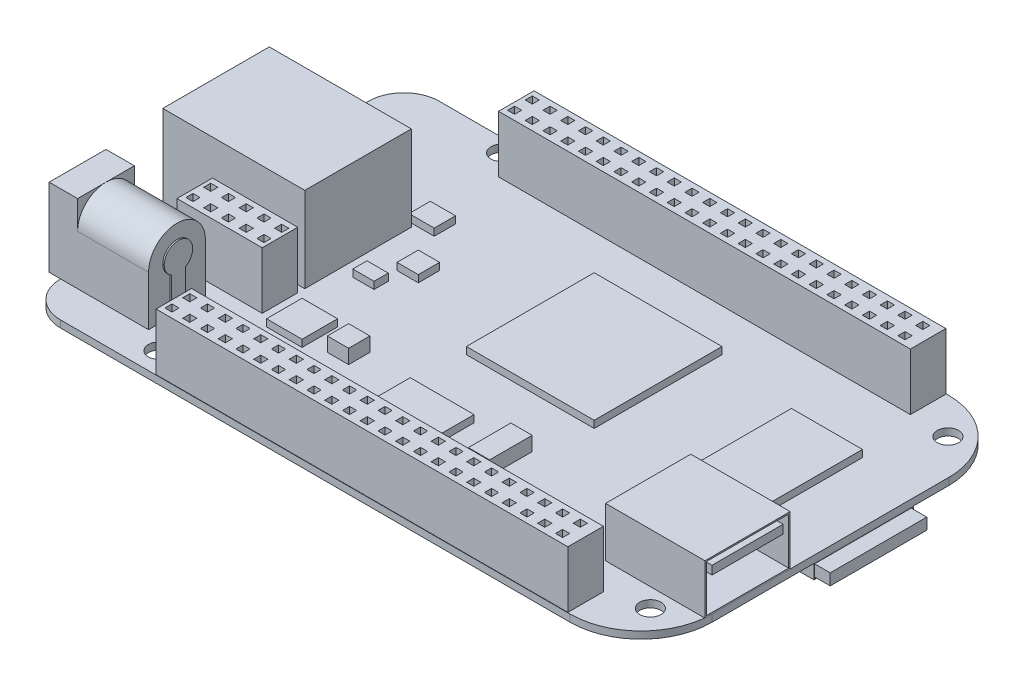
from build123d import *

# Parameters (mm, degrees)
SKETCH1_R               = 1.5
BOSS_EXTRUDE3_DEPTH     = 1
SKETCH2_W               = 12
SKETCH2_H               = 5
SKETCH2_W_2             = 58
BOSS_EXTRUDE5_DEPTH     = 8
SKETCH3_W               = 1
SKETCH3_H               = 1
CUT_EXTRUDE2_DEPTH      = 7
SKETCH4_W               = 20
SKETCH4_H               = 15
BOSS_EXTRUDE6_DEPTH     = 12
CUT_EXTRUDE3_DEPTH      = 15
SKETCH6_W               = 14
SKETCH6_H               = 8
BOSS_EXTRUDE7_DEPTH     = 11
CUT_EXTRUDE5_DEPTH      = 10
SKETCH9_R               = 3
SKETCH9_R_2             = 0.2
CUT_EXTRUDE6_DEPTH      = 10
SKETCH10_W              = 14
SKETCH10_H              = 12
BOSS_EXTRUDE9_DEPTH     = 7
SKETCH11_W              = 11.6
SKETCH11_H              = 6.6
SKETCH11_W_2            = 10
SKETCH11_H_2            = 1.2
CUT_EXTRUDE7_DEPTH      = 10
SKETCH12_W              = 15
SKETCH12_H              = 14
BOSS_EXTRUDE11_DEPTH    = 2
SHELL1_T                = -0.1
SKETCH13_W              = 13.6
SKETCH13_H              = 1.6
BOSS_EXTRUDE12_DEPTH    = 17
SKETCH14_W              = 18
SKETCH14_H              = 18
BOSS_EXTRUDE13_DEPTH    = 1
SKETCH14_W_2            = 10
SKETCH14_H_2            = 13
BOSS_EXTRUDE13_2_DEPTH  = 1
SKETCH14_W_3            = 3.540159879
SKETCH14_H_3            = 3
BOSS_EXTRUDE13_3_DEPTH  = 1
SKETCH14_W_4            = 3
BOSS_EXTRUDE13_4_DEPTH  = 1
SKETCH14_H_4            = 2
BOSS_EXTRUDE13_5_DEPTH  = 1
SKETCH14_W_5            = 9
SKETCH14_H_5            = 9
BOSS_EXTRUDE13_6_DEPTH  = 1
SKETCH14_W_6            = 5
SKETCH14_H_6            = 5
BOSS_EXTRUDE13_7_DEPTH  = 1
SKETCH15_W              = 8
SKETCH15_H              = 7
BOSS_EXTRUDE14_DEPTH    = 4
CUT_EXTRUDE8_DEPTH      = 94.673517471
CUT_EXTRUDE8_DEPTH_BACK = 94.673517471
SHELL2_T                = -0.1
BOSS_EXTRUDE15_DEPTH    = 7
SKETCH18_R              = 0.1
CUT_EXTRUDE9_DEPTH      = 6
SKETCH19_W              = 3
SKETCH19_H              = 3
SKETCH19_H_2            = 6
SKETCH19_W_2            = 1.784134307
SKETCH19_H_3            = 3.811559656
BOSS_EXTRUDE17_DEPTH    = 2
BOSS_EXTRUDE18_DEPTH    = 0.2


with BuildPart() as part:
    # Sketch1 → Boss-Extrude3 (new body)
    with BuildSketch(Plane(origin=(0, 0, 0), x_dir=(1, 0, 0), z_dir=(0, 1, 0))):
        with BuildLine():
            Line((-38.570655458, -26.67), (33.18, -26.67))
            ThreePointArc((33.18, -26.67), (40.251067812, -23.741067812), (43.18, -16.67))
            Line((43.18, -16.67), (43.18, 16.67))
            ThreePointArc((43.18, 16.67), (40.251067812, 23.741067812), (33.18, 26.67))
            Line((33.18, 26.67), (-38.570655458, 26.67))
            ThreePointArc((-38.570655458, 26.67), (-42.106189364, 25.205533906), (-43.570655458, 21.67))
            Line((-43.570655458, 21.67), (-43.570655458, -21.67))
            ThreePointArc((-43.570655458, -21.67), (-42.106189364, -25.205533906), (-38.570655458, -26.67))
        make_face()
        with Locations((38.14309061, -20.32)):
            Circle(SKETCH1_R, mode=Mode.SUBTRACT)
        with Locations((38.14309061, 21.59)):
            Circle(SKETCH1_R, mode=Mode.SUBTRACT)
        with Locations((-27.89690939, -23.495)):
            Circle(SKETCH1_R, mode=Mode.SUBTRACT)
        with Locations((-27.89690939, 24.765)):
            Circle(SKETCH1_R, mode=Mode.SUBTRACT)
    extrude(amount=BOSS_EXTRUDE3_DEPTH)

    # Sketch2 → Boss-Extrude5 (add)
    with BuildSketch(Plane(origin=(0, 1, 0), x_dir=(1, 0, 0), z_dir=(0, 1, 0))):
        with Locations((-31.18, -9.17)):
            Rectangle(SKETCH2_W, SKETCH2_H)
        with Locations((3.82, -24.12)):
            Rectangle(SKETCH2_W_2, SKETCH2_H)
        with Locations((3.82, 24.12)):
            Rectangle(SKETCH2_W_2, SKETCH2_H)
    extrude(amount=BOSS_EXTRUDE5_DEPTH)

    # Sketch3 → Cut-Extrude2 (cut)
    with BuildSketch(Plane(origin=(0, 9, 0), x_dir=(1, 0, 0), z_dir=(0, 1, 0))):
        with Locations((-21.68, 25.37)):
            Rectangle(SKETCH3_W, SKETCH3_H)
        with Locations((-21.68, -22.87)):
            Rectangle(SKETCH3_W, SKETCH3_H)
        with Locations((-24.18, 25.37)):
            Rectangle(SKETCH3_W, SKETCH3_H)
        with Locations((-19.18, 25.37)):
            Rectangle(SKETCH3_W, SKETCH3_H)
        with Locations((-16.68, 25.37)):
            Rectangle(SKETCH3_W, SKETCH3_H)
        with Locations((-14.18, 25.37)):
            Rectangle(SKETCH3_W, SKETCH3_H)
        with Locations((-11.68, 25.37)):
            Rectangle(SKETCH3_W, SKETCH3_H)
        with Locations((-9.18, 25.37)):
            Rectangle(SKETCH3_W, SKETCH3_H)
        with Locations((-6.68, 25.37)):
            Rectangle(SKETCH3_W, SKETCH3_H)
        with Locations((-4.18, 25.37)):
            Rectangle(SKETCH3_W, SKETCH3_H)
        with Locations((-1.68, 25.37)):
            Rectangle(SKETCH3_W, SKETCH3_H)
        with Locations((0.82, 25.37)):
            Rectangle(SKETCH3_W, SKETCH3_H)
        with Locations((3.32, 25.37)):
            Rectangle(SKETCH3_W, SKETCH3_H)
        with Locations((5.82, 25.37)):
            Rectangle(SKETCH3_W, SKETCH3_H)
        with Locations((8.32, 25.37)):
            Rectangle(SKETCH3_W, SKETCH3_H)
        with Locations((10.82, 25.37)):
            Rectangle(SKETCH3_W, SKETCH3_H)
        with Locations((13.32, 25.37)):
            Rectangle(SKETCH3_W, SKETCH3_H)
        with Locations((15.82, 25.37)):
            Rectangle(SKETCH3_W, SKETCH3_H)
        with Locations((18.32, 25.37)):
            Rectangle(SKETCH3_W, SKETCH3_H)
        with Locations((20.82, 25.37)):
            Rectangle(SKETCH3_W, SKETCH3_H)
        with Locations((23.32, 25.37)):
            Rectangle(SKETCH3_W, SKETCH3_H)
        with Locations((25.82, 25.37)):
            Rectangle(SKETCH3_W, SKETCH3_H)
        with Locations((28.32, 25.37)):
            Rectangle(SKETCH3_W, SKETCH3_H)
        with Locations((30.82, 25.37)):
            Rectangle(SKETCH3_W, SKETCH3_H)
        with Locations((-19.18, 22.87)):
            Rectangle(SKETCH3_W, SKETCH3_H)
        with Locations((-21.68, 22.87)):
            Rectangle(SKETCH3_W, SKETCH3_H)
        with Locations((-24.18, 22.87)):
            Rectangle(SKETCH3_W, SKETCH3_H)
        with Locations((30.82, 22.87)):
            Rectangle(SKETCH3_W, SKETCH3_H)
        with Locations((28.32, 22.87)):
            Rectangle(SKETCH3_W, SKETCH3_H)
        with Locations((25.82, 22.87)):
            Rectangle(SKETCH3_W, SKETCH3_H)
        with Locations((23.32, 22.87)):
            Rectangle(SKETCH3_W, SKETCH3_H)
        with Locations((20.82, 22.87)):
            Rectangle(SKETCH3_W, SKETCH3_H)
        with Locations((18.32, 22.87)):
            Rectangle(SKETCH3_W, SKETCH3_H)
        with Locations((15.82, 22.87)):
            Rectangle(SKETCH3_W, SKETCH3_H)
        with Locations((13.32, 22.87)):
            Rectangle(SKETCH3_W, SKETCH3_H)
        with Locations((10.82, 22.87)):
            Rectangle(SKETCH3_W, SKETCH3_H)
        with Locations((8.32, 22.87)):
            Rectangle(SKETCH3_W, SKETCH3_H)
        with Locations((5.82, 22.87)):
            Rectangle(SKETCH3_W, SKETCH3_H)
        with Locations((3.32, 22.87)):
            Rectangle(SKETCH3_W, SKETCH3_H)
        with Locations((0.82, 22.87)):
            Rectangle(SKETCH3_W, SKETCH3_H)
        with Locations((-1.68, 22.87)):
            Rectangle(SKETCH3_W, SKETCH3_H)
        with Locations((-4.18, 22.87)):
            Rectangle(SKETCH3_W, SKETCH3_H)
        with Locations((-6.68, 22.87)):
            Rectangle(SKETCH3_W, SKETCH3_H)
        with Locations((-9.18, 22.87)):
            Rectangle(SKETCH3_W, SKETCH3_H)
        with Locations((-11.68, 22.87)):
            Rectangle(SKETCH3_W, SKETCH3_H)
        with Locations((-14.18, 22.87)):
            Rectangle(SKETCH3_W, SKETCH3_H)
        with Locations((-16.68, 22.87)):
            Rectangle(SKETCH3_W, SKETCH3_H)
        with Locations((-24.18, -22.87)):
            Rectangle(SKETCH3_W, SKETCH3_H)
        with Locations((-19.18, -22.87)):
            Rectangle(SKETCH3_W, SKETCH3_H)
        with Locations((-16.68, -22.87)):
            Rectangle(SKETCH3_W, SKETCH3_H)
        with Locations((-14.18, -22.87)):
            Rectangle(SKETCH3_W, SKETCH3_H)
        with Locations((-11.68, -22.87)):
            Rectangle(SKETCH3_W, SKETCH3_H)
        with Locations((-9.18, -22.87)):
            Rectangle(SKETCH3_W, SKETCH3_H)
        with Locations((-6.68, -22.87)):
            Rectangle(SKETCH3_W, SKETCH3_H)
        with Locations((-4.18, -22.87)):
            Rectangle(SKETCH3_W, SKETCH3_H)
        with Locations((-1.68, -22.87)):
            Rectangle(SKETCH3_W, SKETCH3_H)
        with Locations((0.82, -22.87)):
            Rectangle(SKETCH3_W, SKETCH3_H)
        with Locations((3.32, -22.87)):
            Rectangle(SKETCH3_W, SKETCH3_H)
        with Locations((5.82, -22.87)):
            Rectangle(SKETCH3_W, SKETCH3_H)
        with Locations((8.32, -22.87)):
            Rectangle(SKETCH3_W, SKETCH3_H)
        with Locations((10.82, -22.87)):
            Rectangle(SKETCH3_W, SKETCH3_H)
        with Locations((13.32, -22.87)):
            Rectangle(SKETCH3_W, SKETCH3_H)
        with Locations((15.82, -22.87)):
            Rectangle(SKETCH3_W, SKETCH3_H)
        with Locations((18.32, -22.87)):
            Rectangle(SKETCH3_W, SKETCH3_H)
        with Locations((20.82, -22.87)):
            Rectangle(SKETCH3_W, SKETCH3_H)
        with Locations((23.32, -22.87)):
            Rectangle(SKETCH3_W, SKETCH3_H)
        with Locations((25.82, -22.87)):
            Rectangle(SKETCH3_W, SKETCH3_H)
        with Locations((28.32, -22.87)):
            Rectangle(SKETCH3_W, SKETCH3_H)
        with Locations((30.82, -22.87)):
            Rectangle(SKETCH3_W, SKETCH3_H)
        with Locations((30.82, -25.37)):
            Rectangle(SKETCH3_W, SKETCH3_H)
        with Locations((28.32, -25.37)):
            Rectangle(SKETCH3_W, SKETCH3_H)
        with Locations((25.82, -25.37)):
            Rectangle(SKETCH3_W, SKETCH3_H)
        with Locations((23.32, -25.37)):
            Rectangle(SKETCH3_W, SKETCH3_H)
        with Locations((20.82, -25.37)):
            Rectangle(SKETCH3_W, SKETCH3_H)
        with Locations((18.32, -25.37)):
            Rectangle(SKETCH3_W, SKETCH3_H)
        with Locations((15.82, -25.37)):
            Rectangle(SKETCH3_W, SKETCH3_H)
        with Locations((13.32, -25.37)):
            Rectangle(SKETCH3_W, SKETCH3_H)
        with Locations((10.82, -25.37)):
            Rectangle(SKETCH3_W, SKETCH3_H)
        with Locations((8.32, -25.37)):
            Rectangle(SKETCH3_W, SKETCH3_H)
        with Locations((5.82, -25.37)):
            Rectangle(SKETCH3_W, SKETCH3_H)
        with Locations((3.32, -25.37)):
            Rectangle(SKETCH3_W, SKETCH3_H)
        with Locations((0.82, -25.37)):
            Rectangle(SKETCH3_W, SKETCH3_H)
        with Locations((-1.68, -25.37)):
            Rectangle(SKETCH3_W, SKETCH3_H)
        with Locations((-4.18, -25.37)):
            Rectangle(SKETCH3_W, SKETCH3_H)
        with Locations((-6.68, -25.37)):
            Rectangle(SKETCH3_W, SKETCH3_H)
        with Locations((-9.18, -25.37)):
            Rectangle(SKETCH3_W, SKETCH3_H)
        with Locations((-11.68, -25.37)):
            Rectangle(SKETCH3_W, SKETCH3_H)
        with Locations((-14.18, -25.37)):
            Rectangle(SKETCH3_W, SKETCH3_H)
        with Locations((-16.68, -25.37)):
            Rectangle(SKETCH3_W, SKETCH3_H)
        with Locations((-19.18, -25.37)):
            Rectangle(SKETCH3_W, SKETCH3_H)
        with Locations((-21.68, -25.37)):
            Rectangle(SKETCH3_W, SKETCH3_H)
        with Locations((-24.18, -25.37)):
            Rectangle(SKETCH3_W, SKETCH3_H)
        with Locations((-28.68, -10.42)):
            Rectangle(SKETCH3_W, SKETCH3_H)
        with Locations((-26.18, -10.42)):
            Rectangle(SKETCH3_W, SKETCH3_H)
        with Locations((-31.18, -10.42)):
            Rectangle(SKETCH3_W, SKETCH3_H)
        with Locations((-33.68, -10.42)):
            Rectangle(SKETCH3_W, SKETCH3_H)
        with Locations((-36.18, -10.42)):
            Rectangle(SKETCH3_W, SKETCH3_H)
        with Locations((-36.18, -7.92)):
            Rectangle(SKETCH3_W, SKETCH3_H)
        with Locations((-33.68, -7.92)):
            Rectangle(SKETCH3_W, SKETCH3_H)
        with Locations((-31.18, -7.92)):
            Rectangle(SKETCH3_W, SKETCH3_H)
        with Locations((-28.68, -7.92)):
            Rectangle(SKETCH3_W, SKETCH3_H)
        with Locations((-26.18, -7.92)):
            Rectangle(SKETCH3_W, SKETCH3_H)
    extrude(amount=-CUT_EXTRUDE2_DEPTH, mode=Mode.SUBTRACT)

    # Sketch4 → Boss-Extrude6 (add)
    with BuildSketch(Plane(origin=(0, 1, 0), x_dir=(1, 0, 0), z_dir=(0, 1, 0))):
        with Locations((-35.18, 1.83)):
            Rectangle(SKETCH4_W, SKETCH4_H)
    extrude(amount=BOSS_EXTRUDE6_DEPTH)

    # Sketch5 → Cut-Extrude3 (cut)
    with BuildSketch(Plane.ZY.offset(45.18)):
        Polygon((-4.33, 2), (-5.33, 2), (-5.33, 4), (-8.33, 4), (-8.33, 11), (4.67, 11), (4.67, 4), (1.67, 4), (1.67, 2), (0.67, 2), (0.67, 1.05), (-4.33, 1.05), align=None)
    extrude(amount=-CUT_EXTRUDE3_DEPTH, mode=Mode.SUBTRACT)

    # Sketch6 → Boss-Extrude7 (add)
    with BuildSketch(Plane(origin=(0, 1, 0), x_dir=(1, 0, 0), z_dir=(0, 1, 0))):
        with Locations((-38.18, -17.67)):
            Rectangle(SKETCH6_W, SKETCH6_H)
    extrude(amount=BOSS_EXTRUDE7_DEPTH)

    # Sketch8 → Cut-Extrude5 (cut)
    with BuildSketch(Plane(origin=(-31.18, 0, 0), x_dir=(0, 0, -1), z_dir=(1, 0, 0))):
        with BuildLine():
            ThreePointArc((-17.67, 12), (-14.841572875, 10.828427125), (-13.67, 8))
            Line((-13.67, 8), (-13.67, 12))
            Line((-13.67, 12), (-17.67, 12))
        make_face()
        with BuildLine():
            ThreePointArc((-21.67, 8), (-20.498427125, 10.828427125), (-17.67, 12))
            Line((-17.67, 12), (-21.67, 12))
            Line((-21.67, 12), (-21.67, 8))
        make_face()
    extrude(amount=-CUT_EXTRUDE5_DEPTH, mode=Mode.SUBTRACT)

    # Sketch9 → Cut-Extrude6 (cut)
    with BuildSketch(Plane.ZY.offset(45.18)):
        with Locations((17.67, 8)):
            Circle(SKETCH9_R)
        with Locations((17.67, 8)):
            Circle(SKETCH9_R_2, mode=Mode.SUBTRACT)
    extrude(amount=-CUT_EXTRUDE6_DEPTH, mode=Mode.SUBTRACT)

    # Sketch19 → Boss-Extrude17 (add)
    with BuildSketch(Plane(origin=(0, 1, 0), x_dir=(1, 0, 0), z_dir=(0, 1, 0))):
        with Locations((-17.597159489, -18.143567327)):
            Rectangle(SKETCH19_W, SKETCH19_H)
        with Locations((-23.128561119, -18.143567327)):
            Rectangle(SKETCH19_W, SKETCH19_H)
        with Locations((-14.335050835, -10.342872721)):
            Rectangle(SKETCH19_W, SKETCH19_H)
        with Locations((9.208863795, -12.530473807)):
            Rectangle(SKETCH19_W, SKETCH19_H_2)
        with Locations((27.18650391, -11.971397323)):
            Rectangle(SKETCH19_W_2, SKETCH19_H_3)
    extrude(amount=BOSS_EXTRUDE17_DEPTH)

    # Sketch20 → Boss-Extrude18 (add)
    with BuildSketch(Plane(origin=(-31.18, 0, 0), x_dir=(0, 0, -1), z_dir=(1, 0, 0))):
        with BuildLine():
            Line((-18.67, 6.267949192), (-18.67, 1))
            Line((-18.67, 1), (-16.67, 1))
            Line((-16.67, 1), (-16.67, 6.267949192))
            ThreePointArc((-16.67, 6.267949192), (-17.67, 10), (-18.67, 6.267949192))
        make_face()
    extrude(amount=BOSS_EXTRUDE18_DEPTH)


with BuildPart() as body_2:
    # Sketch10 → Boss-Extrude9 (new body)
    with BuildSketch(Plane(origin=(0, 1, 0), x_dir=(1, 0, 0), z_dir=(0, 1, 0))):
        with Locations((36.18, -11.67)):
            Rectangle(SKETCH10_W, SKETCH10_H)
    extrude(amount=BOSS_EXTRUDE9_DEPTH)

    # Sketch11 → Cut-Extrude7 (cut)
    with BuildSketch(Plane(origin=(43.18, 0, 0), x_dir=(0, 0, -1), z_dir=(1, 0, 0))):
        with Locations((-11.67, 4.5)):
            Rectangle(SKETCH11_W, SKETCH11_H)
        with Locations((-11.67, 6.352552878)):
            Rectangle(SKETCH11_W_2, SKETCH11_H_2, mode=Mode.SUBTRACT)
    extrude(amount=-CUT_EXTRUDE7_DEPTH, mode=Mode.SUBTRACT)


with BuildPart() as body_3:
    # Sketch12 → Boss-Extrude11 (new body)
    with BuildSketch(Plane.XZ):
        with Locations((35.68, -4.67)):
            Rectangle(SKETCH12_W, SKETCH12_H)
    extrude(amount=BOSS_EXTRUDE11_DEPTH)

    # Shell1
    shell1_openings = [body_3.faces().sort_by_distance(p)[0] for p in [
        (43.18, -1, -4.67),
    ]]
    offset(amount=SHELL1_T, openings=shell1_openings, kind=Kind.INTERSECTION)

    # Sketch13 → Boss-Extrude12 (add)
    with BuildSketch(Plane(origin=(28.28, 0, 0), x_dir=(0, 0, -1), z_dir=(1, 0, 0))):
        with Locations((4.67, -0.992724209)):
            Rectangle(SKETCH13_W, SKETCH13_H)
    extrude(amount=BOSS_EXTRUDE12_DEPTH)


with BuildPart() as body_4:
    # Sketch14 → Boss-Extrude13 (new body)
    with BuildSketch(Plane(origin=(0, 1, 0), x_dir=(1, 0, 0), z_dir=(0, 1, 0))):
        with Locations((3.244137797, 6.663494479)):
            Rectangle(SKETCH14_W, SKETCH14_H)
    extrude(amount=BOSS_EXTRUDE13_DEPTH)


with BuildPart() as body_5:
    # Sketch14 → Boss-Extrude13 2 (new body)
    with BuildSketch(Plane(origin=(0, 1, 0), x_dir=(1, 0, 0), z_dir=(0, 1, 0))):
        with Locations((29.689512762, 6.5)):
            Rectangle(SKETCH14_W_2, SKETCH14_H_2)
    extrude(amount=BOSS_EXTRUDE13_2_DEPTH)


with BuildPart() as body_6:
    # Sketch14 → Boss-Extrude13 3 (new body)
    with BuildSketch(Plane(origin=(0, 1, 0), x_dir=(1, 0, 0), z_dir=(0, 1, 0))):
        with Locations((-24.235496774, 11.341644465)):
            Rectangle(SKETCH14_W_3, SKETCH14_H_3)
    extrude(amount=BOSS_EXTRUDE13_3_DEPTH)


with BuildPart() as body_7:
    # Sketch14 → Boss-Extrude13 4 (new body)
    with BuildSketch(Plane(origin=(0, 1, 0), x_dir=(1, 0, 0), z_dir=(0, 1, 0))):
        with Locations((-19.407746488, 4.544537497)):
            Rectangle(SKETCH14_W_4, SKETCH14_H_3)
    extrude(amount=BOSS_EXTRUDE13_4_DEPTH)


with BuildPart() as body_8:
    # Sketch14 → Boss-Extrude13 5 (new body)
    with BuildSketch(Plane(origin=(0, 1, 0), x_dir=(1, 0, 0), z_dir=(0, 1, 0))):
        with Locations((-21.711565187, 0.116495093)):
            Rectangle(SKETCH14_W_4, SKETCH14_H_4)
    extrude(amount=BOSS_EXTRUDE13_5_DEPTH)


with BuildPart() as body_9:
    # Sketch14 → Boss-Extrude13 6 (new body)
    with BuildSketch(Plane(origin=(0, 1, 0), x_dir=(1, 0, 0), z_dir=(0, 1, 0))):
        with Locations((-1.406894063, -14.595421376)):
            Rectangle(SKETCH14_W_5, SKETCH14_H_5)
    extrude(amount=BOSS_EXTRUDE13_6_DEPTH)


with BuildPart() as body_10:
    # Sketch14 → Boss-Extrude13 7 (new body)
    with BuildSketch(Plane(origin=(0, 1, 0), x_dir=(1, 0, 0), z_dir=(0, 1, 0))):
        with Locations((-20.711565187, -10.524782553)):
            Rectangle(SKETCH14_W_6, SKETCH14_H_6)
    extrude(amount=BOSS_EXTRUDE13_7_DEPTH)


with BuildPart() as body_11:
    # Sketch15 → Boss-Extrude14 (new body)
    with BuildSketch(Plane.XZ):
        with Locations((-39.570655458, -18.17)):
            Rectangle(SKETCH15_W, SKETCH15_H)
    extrude(amount=BOSS_EXTRUDE14_DEPTH)

    # Sketch16 → Cut-Extrude8 (cut, two sides: drawn at the far end of the back side and taken through both)
    with BuildSketch(Plane.ZY.offset(43.570655458).offset(-CUT_EXTRUDE8_DEPTH_BACK)):
        Polygon((-21.67, 0), (-21.67, -0.5), (-21.17, 0), align=None)
        Polygon((-14.67, 0), (-15.17, 0), (-14.67, -0.5), align=None)
    extrude(amount=CUT_EXTRUDE8_DEPTH + CUT_EXTRUDE8_DEPTH_BACK, mode=Mode.SUBTRACT)

    # Shell2
    shell2_openings = [body_11.faces().sort_by_distance(p)[0] for p in [
        (-43.570655458, -2.016516517, -18.17),
    ]]
    offset(amount=SHELL2_T, openings=shell2_openings, kind=Kind.INTERSECTION)


with BuildPart() as body_12:
    # Sketch17 → Boss-Extrude15 (new body)
    with BuildSketch(Plane.ZY.offset(35.670655458)):
        Polygon((-21.075025253, -1.036396103), (-21.075025253, -2.036396103), (-15.264974747, -2.036396103), (-15.264974747, -1.036396103), (-15.50137085, -0.8), (-20.83862915, -0.8), align=None)
    extrude(amount=BOSS_EXTRUDE15_DEPTH)

    # Sketch18 → Cut-Extrude9 (cut)
    with BuildSketch(Plane.ZY.offset(42.670655458)):
        with Locations((-20.549170488, -1.468317207)):
            Circle(SKETCH18_R)
        with Locations((-19.349170488, -1.468317207)):
            Circle(SKETCH18_R)
        with Locations((-18.149170488, -1.468317207)):
            Circle(SKETCH18_R)
        with Locations((-16.949170488, -1.468317207)):
            Circle(SKETCH18_R)
        with Locations((-15.749170488, -1.468317207)):
            Circle(SKETCH18_R)
    extrude(amount=-CUT_EXTRUDE9_DEPTH, mode=Mode.SUBTRACT)


solid = Compound([part.part, body_2.part, body_3.part, body_4.part, body_5.part, body_6.part, body_7.part, body_8.part, body_9.part, body_10.part, body_11.part, body_12.part])
